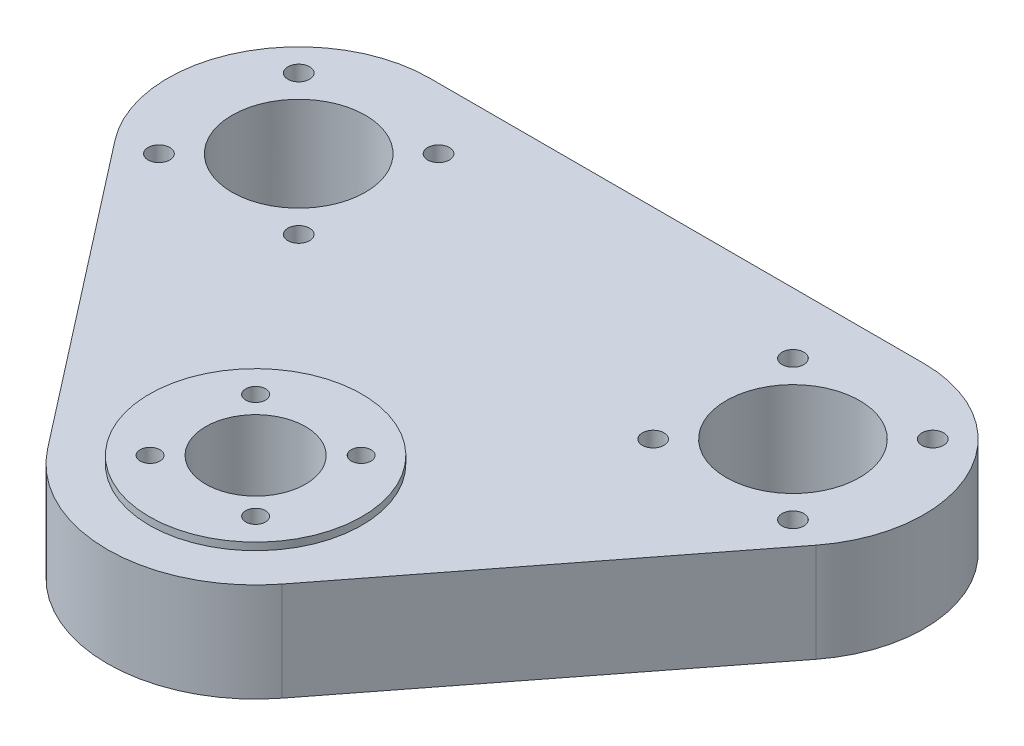
from build123d import *

# Parameters (mm, degrees)
BOSS_EXTRUDE1_DEPTH = 20
SKETCH3_R           = 21.5
BOSS_EXTRUDE2_DEPTH = 1.5
SKETCH4_R           = 10.1
SKETCH4_R_2         = 13.5
SKETCH4_R_3         = 2
SKETCH4_R_4         = 2.2
CUT_EXTRUDE1_DEPTH  = 117.521578125


with BuildPart() as part:
    # Sketch1 → Boss-Extrude1 (new body)
    with BuildSketch(Plane(origin=(0, 0, 0), x_dir=(1, 0, 0), z_dir=(0, 1, 0))):
        with BuildLine():
            Line((-70.935594667, 42.475369736), (-23.700673208, -18.392337793))
            ThreePointArc((-23.700673208, -18.392337793), (0, -30), (23.700673208, -18.392337793))
            Line((23.700673208, -18.392337793), (70.935594667, 42.475369736))
            ThreePointArc((70.935594667, 42.475369736), (73.7989913, 70.377749347), (50, 85.221934786))
            Line((50, 85.221934786), (-50, 85.221934786))
            ThreePointArc((-50, 85.221934786), (-73.7989913, 70.377749347), (-70.935594667, 42.475369736))
        make_face()
    extrude(amount=BOSS_EXTRUDE1_DEPTH)

    # Sketch3 → Boss-Extrude2 (add)
    with BuildSketch(Plane(origin=(0, 20, 0), x_dir=(1, 0, 0), z_dir=(0, 1, 0))):
        Circle(SKETCH3_R)
    extrude(amount=BOSS_EXTRUDE2_DEPTH)

    # Sketch4 → Cut-Extrude1 (cut, through all)
    with BuildSketch(Plane.XZ):
        Circle(SKETCH4_R)
        with Locations((-50, -58.721934786)):
            Circle(SKETCH4_R_2)
        with Locations((-10.677312396, 10.677312396)):
            Circle(SKETCH4_R_3)
        with Locations((-10.677312396, -10.677312396)):
            Circle(SKETCH4_R_3)
        with Locations((-64.142135624, -44.579799162)):
            Circle(SKETCH4_R_4)
        with Locations((-64.142135624, -72.86407041)):
            Circle(SKETCH4_R_4)
        with Locations((-35.857864376, -72.86407041)):
            Circle(SKETCH4_R_4)
        with Locations((-35.857864376, -44.579799162)):
            Circle(SKETCH4_R_4)
        with Locations((50, -58.721934786)):
            Circle(SKETCH4_R_2)
        with Locations((64.142135624, -72.86407041)):
            Circle(SKETCH4_R_4)
        with Locations((35.857864376, -72.86407041)):
            Circle(SKETCH4_R_4)
        with Locations((35.857864376, -44.579799162)):
            Circle(SKETCH4_R_4)
        with Locations((64.142135624, -44.579799162)):
            Circle(SKETCH4_R_4)
        with Locations((10.677312396, -10.677312396)):
            Circle(SKETCH4_R_3)
        with Locations((10.677312396, 10.677312396)):
            Circle(SKETCH4_R_3)
    extrude(amount=-CUT_EXTRUDE1_DEPTH, mode=Mode.SUBTRACT)


solid = part.part
